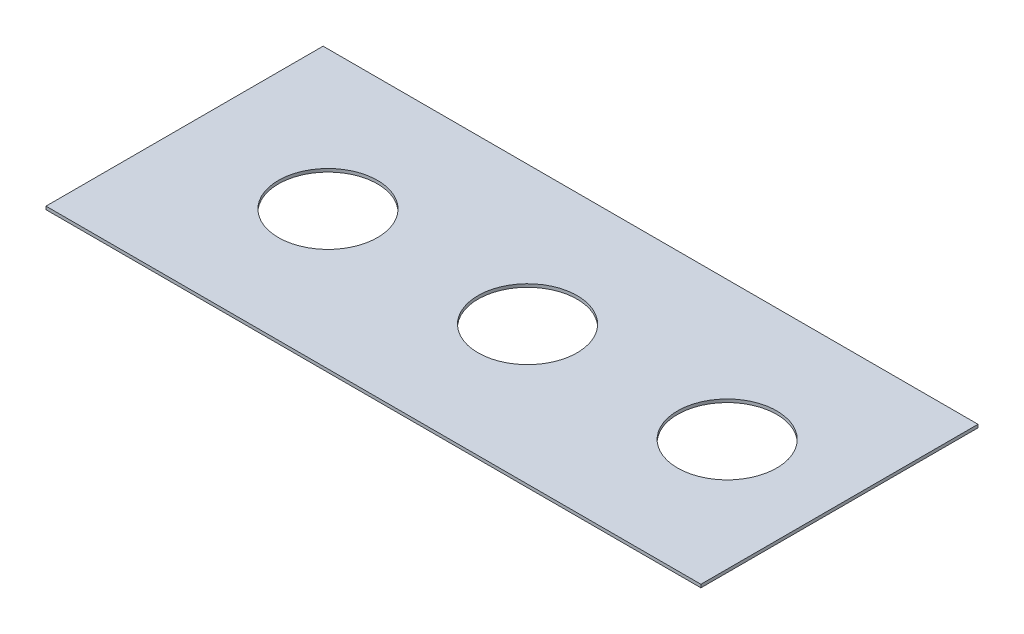
from build123d import *

# Parameters (mm, degrees)
SKETCH1_W           = 330.2
SKETCH1_H           = 139.7
SKETCH1_R           = 24.9936
BOSS_EXTRUDE1_DEPTH = 1.5748


with BuildPart() as part:
    # Sketch1 → Boss-Extrude1 (new body)
    with BuildSketch(Plane(origin=(0, 0, 0), x_dir=(1, 0, 0), z_dir=(0, 1, 0))):
        Rectangle(SKETCH1_W, SKETCH1_H)
        with Locations((-92.7862, 0)):
            Circle(SKETCH1_R, mode=Mode.SUBTRACT)
        with Locations((7.8486, 0)):
            Circle(SKETCH1_R, mode=Mode.SUBTRACT)
        with Locations((108.4834, 0)):
            Circle(SKETCH1_R, mode=Mode.SUBTRACT)
    extrude(amount=BOSS_EXTRUDE1_DEPTH)


solid = part.part
